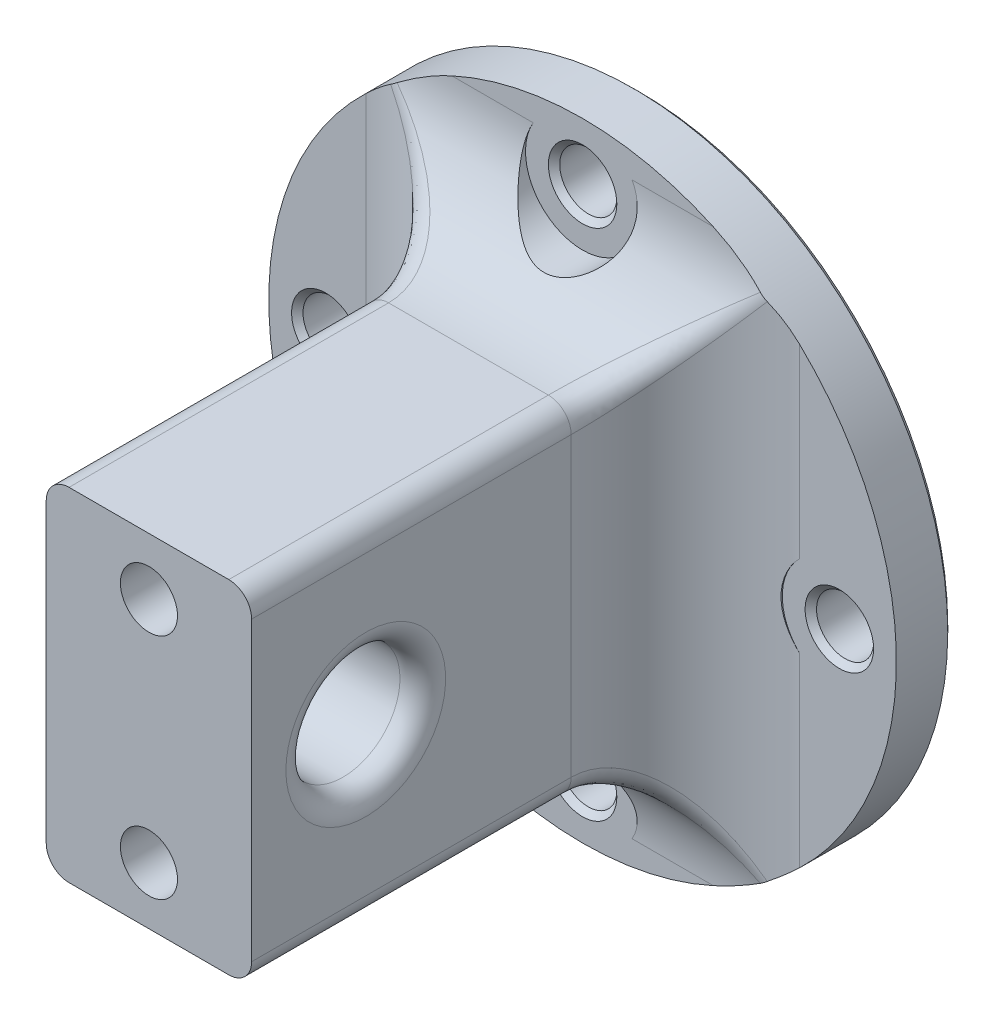
from build123d import *

# Parameters (mm, degrees)
SKETCH1_R           = 27.5
SKETCH1_R_2         = 2.5
BOSS_EXTRUDE1_DEPTH = 5
SKETCH2_W           = 18
SKETCH2_H           = 30
SKETCH2_R           = 2.5
BOSS_EXTRUDE2_DEPTH = 38
CUT_EXTRUDE1_START  = -15
SKETCH3_R           = 4.375
CUT_EXTRUDE1_DEPTH  = 20
FILLET1_R           = 10
SKETCH4_R           = 5
CUT_EXTRUDE2_DEPTH  = 55.373706982
CHAMFER1_SIZE       = 0.5
CHAMFER2_SIZE       = 2
SKETCH7_R           = 5
CUT_EXTRUDE4_DEPTH  = 63.749502092
FILLET4_R           = 2
FILLET5_R           = 2


with BuildPart() as part:
    # Sketch1 → Boss-Extrude1 (new body)
    with BuildSketch(Plane.XY):
        Circle(SKETCH1_R)
        with Locations((0, 22.5)):
            Circle(SKETCH1_R_2, mode=Mode.SUBTRACT)
        with Locations((0, -22.5)):
            Circle(SKETCH1_R_2, mode=Mode.SUBTRACT)
        with Locations((22.5, 0)):
            Circle(SKETCH1_R_2, mode=Mode.SUBTRACT)
        with Locations((-22.5, 0)):
            Circle(SKETCH1_R_2, mode=Mode.SUBTRACT)
    extrude(amount=BOSS_EXTRUDE1_DEPTH)

    # Sketch2 → Boss-Extrude2 (add)
    with BuildSketch(Plane.XY.offset(5)):
        Rectangle(SKETCH2_W, SKETCH2_H)
        with Locations((0, 10)):
            Circle(SKETCH2_R, mode=Mode.SUBTRACT)
        with Locations((0, -10)):
            Circle(SKETCH2_R, mode=Mode.SUBTRACT)
    extrude(amount=BOSS_EXTRUDE2_DEPTH)

    # Sketch3 → Cut-Extrude1 (cut)
    with BuildSketch(Plane(origin=(0, 0, 0), x_dir=(-1, 0, 0), z_dir=(0, 0, -1)).offset(CUT_EXTRUDE1_START)):
        with Locations((0, 10)):
            Circle(SKETCH3_R)
        with Locations((0, -10)):
            Circle(SKETCH3_R)
    extrude(amount=-CUT_EXTRUDE1_DEPTH, mode=Mode.SUBTRACT)

    # Fillet1
    # the kernel refuses this fillet: 10 mm, written as the material it adds along each edge
    with BuildSketch(Plane(origin=(9, -15, 5), x_dir=(1, 0, 0), z_dir=(0, 1, 0)), Plane(origin=(-9, 15, 5), x_dir=(-1, 0, 0), z_dir=(0, -1, 0))) as fillet1_piece_1:
        with BuildLine():
            CenterArc((FILLET1_R, -FILLET1_R), FILLET1_R, 90, 90)
            Line((0, -FILLET1_R), (0, 0))
            Line((0, 0), (FILLET1_R, 0))
        make_face()
    extrude(amount=30)
    with BuildSketch(Plane(origin=(9, 15, 5), x_dir=(0, 1, 0), z_dir=(-1, 0, 0))) as fillet1_piece_2_section:
        with BuildLine():
            CenterArc((FILLET1_R, -FILLET1_R), FILLET1_R, 90, 90)
            Line((0, -FILLET1_R), (0, 0))
            Line((0, 0), (FILLET1_R, 0))
        make_face()
    fillet1_piece_2 = extrude(amount=18, mode=Mode.PRIVATE)
    fillet1_piece_2 = fillet1_piece_2 - Plane(origin=(0, 22.5, 7.318803261), x_dir=(1, 0, 0), z_dir=(0, 0, -1)) * Cylinder(2.5, 76, mode=Mode.PRIVATE)
    add(fillet1_piece_2)
    with BuildSketch(Plane(origin=(-9, -15, 5), x_dir=(0, -1, 0), z_dir=(1, 0, 0))) as fillet1_piece_3_section:
        with BuildLine():
            CenterArc((FILLET1_R, -FILLET1_R), FILLET1_R, 90, 90)
            Line((0, -FILLET1_R), (0, 0))
            Line((0, 0), (FILLET1_R, 0))
        make_face()
    fillet1_piece_3 = extrude(amount=18, mode=Mode.PRIVATE)
    fillet1_piece_3 = fillet1_piece_3 - Plane(origin=(0, -22.5, 7.318801556), x_dir=(1, 0, 0), z_dir=(0, 0, -1)) * Cylinder(2.5, 76, mode=Mode.PRIVATE)
    add(fillet1_piece_3)
    with BuildSketch(Plane(origin=(-9, -15, 5), x_dir=(0, -1, 0), z_dir=(1, 0, 0))) as fillet1_piece_4a_section:
        with BuildLine():
            CenterArc((FILLET1_R, -FILLET1_R), FILLET1_R, 90, 90)
            Line((0, -FILLET1_R), (0, 0))
            Line((0, 0), (FILLET1_R, 0))
        make_face()
    fillet1_piece_4a = extrude(amount=43, mode=Mode.PRIVATE)
    fillet1_piece_4a = fillet1_piece_4a & Plane(origin=(0, 0, 7.463638363), x_dir=(1, 0, 0), z_dir=(0, 0, -1)) * Cylinder(27.5, 126, mode=Mode.PRIVATE)
    fillet1_piece_4a = split(fillet1_piece_4a, bisect_by=Plane(origin=(9, -16.905616824, 7.463638363), z_dir=(1, 0, 0)), keep=Keep.TOP, mode=Mode.PRIVATE)
    with BuildSketch(Plane(origin=(9, -40, 5), x_dir=(1, 0, 0), z_dir=(0, 1, 0))) as fillet1_piece_4b_section:
        with BuildLine():
            CenterArc((FILLET1_R, -FILLET1_R), FILLET1_R, 90, 90)
            Line((0, -FILLET1_R), (0, 0))
            Line((0, 0), (FILLET1_R, 0))
        make_face()
    fillet1_piece_4b = extrude(amount=55, mode=Mode.PRIVATE)
    fillet1_piece_4b = fillet1_piece_4b & Plane(origin=(0, 0, 7.398524713), x_dir=(1, 0, 0), z_dir=(0, 0, -1)) * Cylinder(27.5, 150, mode=Mode.PRIVATE)
    fillet1_piece_4b = split(fillet1_piece_4b, bisect_by=Plane(origin=(11.022922469, -15, 7.398524713), z_dir=(0, -1, 0)), keep=Keep.TOP, mode=Mode.PRIVATE)
    fillet1_piece_4 = fillet1_piece_4a & fillet1_piece_4b
    add(fillet1_piece_4)
    with BuildSketch(Plane(origin=(9, -15, 5), x_dir=(1, 0, 0), z_dir=(0, 1, 0))) as fillet1_piece_5a_section:
        with BuildLine():
            CenterArc((FILLET1_R, -FILLET1_R), FILLET1_R, 90, 90)
            Line((0, -FILLET1_R), (0, 0))
            Line((0, 0), (FILLET1_R, 0))
        make_face()
    fillet1_piece_5a = extrude(amount=55, mode=Mode.PRIVATE)
    fillet1_piece_5a = fillet1_piece_5a & Plane(origin=(0, 0, 7.398526267), x_dir=(1, 0, 0), z_dir=(0, 0, -1)) * Cylinder(27.5, 150, mode=Mode.PRIVATE)
    fillet1_piece_5a = split(fillet1_piece_5a, bisect_by=Plane(origin=(11.022928768, 15, 7.398526267), z_dir=(0, 1, 0)), keep=Keep.TOP, mode=Mode.PRIVATE)
    with BuildSketch(Plane(origin=(34, 15, 5), x_dir=(0, 1, 0), z_dir=(-1, 0, 0))) as fillet1_piece_5b_section:
        with BuildLine():
            CenterArc((FILLET1_R, -FILLET1_R), FILLET1_R, 90, 90)
            Line((0, -FILLET1_R), (0, 0))
            Line((0, 0), (FILLET1_R, 0))
        make_face()
    fillet1_piece_5b = extrude(amount=43, mode=Mode.PRIVATE)
    fillet1_piece_5b = fillet1_piece_5b & Plane(origin=(0, 0, 7.463642047), x_dir=(1, 0, 0), z_dir=(0, 0, -1)) * Cylinder(27.5, 126, mode=Mode.PRIVATE)
    fillet1_piece_5b = split(fillet1_piece_5b, bisect_by=Plane(origin=(9, 16.90562548, 7.463642047), z_dir=(1, 0, 0)), keep=Keep.TOP, mode=Mode.PRIVATE)
    fillet1_piece_5 = fillet1_piece_5a & fillet1_piece_5b
    add(fillet1_piece_5)
    with BuildSketch(Plane(origin=(9, 15, 5), x_dir=(0, 1, 0), z_dir=(-1, 0, 0))) as fillet1_piece_6a_section:
        with BuildLine():
            CenterArc((FILLET1_R, -FILLET1_R), FILLET1_R, 90, 90)
            Line((0, -FILLET1_R), (0, 0))
            Line((0, 0), (FILLET1_R, 0))
        make_face()
    fillet1_piece_6a = extrude(amount=43, mode=Mode.PRIVATE)
    fillet1_piece_6a = fillet1_piece_6a & Plane(origin=(0, 0, 7.463638363), x_dir=(1, 0, 0), z_dir=(0, 0, -1)) * Cylinder(27.5, 126, mode=Mode.PRIVATE)
    fillet1_piece_6a = split(fillet1_piece_6a, bisect_by=Plane(origin=(-9, 16.905616824, 7.463638363), z_dir=(-1, 0, 0)), keep=Keep.TOP, mode=Mode.PRIVATE)
    with BuildSketch(Plane(origin=(-9, 40, 5), x_dir=(-1, 0, 0), z_dir=(0, -1, 0))) as fillet1_piece_6b_section:
        with BuildLine():
            CenterArc((FILLET1_R, -FILLET1_R), FILLET1_R, 90, 90)
            Line((0, -FILLET1_R), (0, 0))
            Line((0, 0), (FILLET1_R, 0))
        make_face()
    fillet1_piece_6b = extrude(amount=55, mode=Mode.PRIVATE)
    fillet1_piece_6b = fillet1_piece_6b & Plane(origin=(0, 0, 7.398524713), x_dir=(1, 0, 0), z_dir=(0, 0, -1)) * Cylinder(27.5, 150, mode=Mode.PRIVATE)
    fillet1_piece_6b = split(fillet1_piece_6b, bisect_by=Plane(origin=(-11.022922469, 15, 7.398524713), z_dir=(0, 1, 0)), keep=Keep.TOP, mode=Mode.PRIVATE)
    fillet1_piece_6 = fillet1_piece_6a & fillet1_piece_6b
    add(fillet1_piece_6)
    with BuildSketch(Plane(origin=(-34, -15, 5), x_dir=(0, -1, 0), z_dir=(1, 0, 0))) as fillet1_piece_7a_section:
        with BuildLine():
            CenterArc((FILLET1_R, -FILLET1_R), FILLET1_R, 90, 90)
            Line((0, -FILLET1_R), (0, 0))
            Line((0, 0), (FILLET1_R, 0))
        make_face()
    fillet1_piece_7a = extrude(amount=43, mode=Mode.PRIVATE)
    fillet1_piece_7a = fillet1_piece_7a & Plane(origin=(0, 0, 7.463642047), x_dir=(1, 0, 0), z_dir=(0, 0, -1)) * Cylinder(27.5, 126, mode=Mode.PRIVATE)
    fillet1_piece_7a = split(fillet1_piece_7a, bisect_by=Plane(origin=(-9, -16.90562548, 7.463642047), z_dir=(-1, 0, 0)), keep=Keep.TOP, mode=Mode.PRIVATE)
    with BuildSketch(Plane(origin=(-9, 15, 5), x_dir=(-1, 0, 0), z_dir=(0, -1, 0))) as fillet1_piece_7b_section:
        with BuildLine():
            CenterArc((FILLET1_R, -FILLET1_R), FILLET1_R, 90, 90)
            Line((0, -FILLET1_R), (0, 0))
            Line((0, 0), (FILLET1_R, 0))
        make_face()
    fillet1_piece_7b = extrude(amount=55, mode=Mode.PRIVATE)
    fillet1_piece_7b = fillet1_piece_7b & Plane(origin=(0, 0, 7.398526267), x_dir=(1, 0, 0), z_dir=(0, 0, -1)) * Cylinder(27.5, 150, mode=Mode.PRIVATE)
    fillet1_piece_7b = split(fillet1_piece_7b, bisect_by=Plane(origin=(-11.022928768, -15, 7.398526267), z_dir=(0, -1, 0)), keep=Keep.TOP, mode=Mode.PRIVATE)
    fillet1_piece_7 = fillet1_piece_7a & fillet1_piece_7b
    add(fillet1_piece_7)

    # Sketch4 → Cut-Extrude2 (cut, through all)
    with BuildSketch(Plane.XY.offset(5)):
        with Locations((0, 22.5)):
            Circle(SKETCH4_R)
        with Locations((0, -22.5)):
            Circle(SKETCH4_R)
        with Locations((-22.5, 0)):
            Circle(SKETCH4_R)
        with Locations((22.5, 0)):
            Circle(SKETCH4_R)
    extrude(amount=CUT_EXTRUDE2_DEPTH, mode=Mode.SUBTRACT)

    # Chamfer1
    chamfer1_edges = [part.edges().sort_by_distance(p)[0] for p in [
        (-2.5, -22.5, 5),
        (20, 0, 0),
        (20, 0, 5),
        (-25, 0, 0),
        (-25, 0, 5),
        (-27.5, 0, 0),
        (-2.5, 22.5, 0),
        (-2.5, -22.5, 0),
        (-2.5, 22.5, 5),
    ]]
    chamfer(chamfer1_edges, length=CHAMFER1_SIZE)

    # Chamfer2
    # the kernel refuses this chamfer: 2 mm, written as the material it adds along each edge
    with BuildSketch(Plane(origin=(0, 10, 35), x_dir=(-1, 0, 0), z_dir=(0, -1, 0))) as chamfer2_piece_1_section:
        Polygon((4.375 - CHAMFER2_SIZE, 0), (4.375, CHAMFER2_SIZE), (4.375, 0), align=None)
    chamfer2_piece_1 = revolve(axis=Axis((0, 10, 35), (0, 0, -1)), mode=Mode.PRIVATE)
    chamfer2_piece_1 = chamfer2_piece_1 - Plane(origin=(0, 10, 33.935444537), x_dir=(1, 0, 0), z_dir=(0, 0, -1)) * Cylinder(2.5, 18, mode=Mode.PRIVATE)
    add(chamfer2_piece_1)
    with BuildSketch(Plane(origin=(0, -10, 35), x_dir=(-1, 0, 0), z_dir=(0, -1, 0))) as chamfer2_piece_2_section:
        Polygon((4.375 - CHAMFER2_SIZE, 0), (4.375, CHAMFER2_SIZE), (4.375, 0), align=None)
    chamfer2_piece_2 = revolve(axis=Axis((0, -10, 35), (0, 0, -1)), mode=Mode.PRIVATE)
    chamfer2_piece_2 = chamfer2_piece_2 - Plane(origin=(0, -10, 33.935444537), x_dir=(1, 0, 0), z_dir=(0, 0, -1)) * Cylinder(2.5, 18, mode=Mode.PRIVATE)
    add(chamfer2_piece_2)

    # Sketch7 → Cut-Extrude4 (cut, through all)
    with BuildSketch(Plane(origin=(9, 0, 0), x_dir=(0, 0, -1), z_dir=(1, 0, 0))):
        with Locations((-33, 0)):
            Circle(SKETCH7_R)
    extrude(amount=-CUT_EXTRUDE4_DEPTH, mode=Mode.SUBTRACT)

    # Fillet4
    fillet4_edges = [part.edges().sort_by_distance(p)[0] for p in [
        (9, -15, 29),
        (9, 15, 29),
        (-9, 15, 29),
        (-9, -15, 29),
        (11.393443939, -17.393443939, 8.50844357),
        (-11.393443938, -17.393443938, 8.508443571),
        (11.393443938, 17.393443938, 8.508443571),
        (-11.393443939, 17.393443939, 8.50844357),
    ]]
    fillet(fillet4_edges, radius=FILLET4_R)

    # Fillet5
    fillet5_edges = [part.edges().sort_by_distance(p)[0] for p in [
        (-9, 0, 38),
        (9, 0, 38),
    ]]
    fillet(fillet5_edges, radius=FILLET5_R)


with BuildPart() as body_2:
    # Split1: the piece on the far side of the plane
    add(part.part)
    split(bisect_by=Plane.XY.offset(15), keep=Keep.BOTTOM)


with BuildPart() as part_1:
    add(part.part)

    # Split1
    split(bisect_by=Plane.XY.offset(15), keep=Keep.TOP)


solid = Compound([body_2.part, part_1.part])
